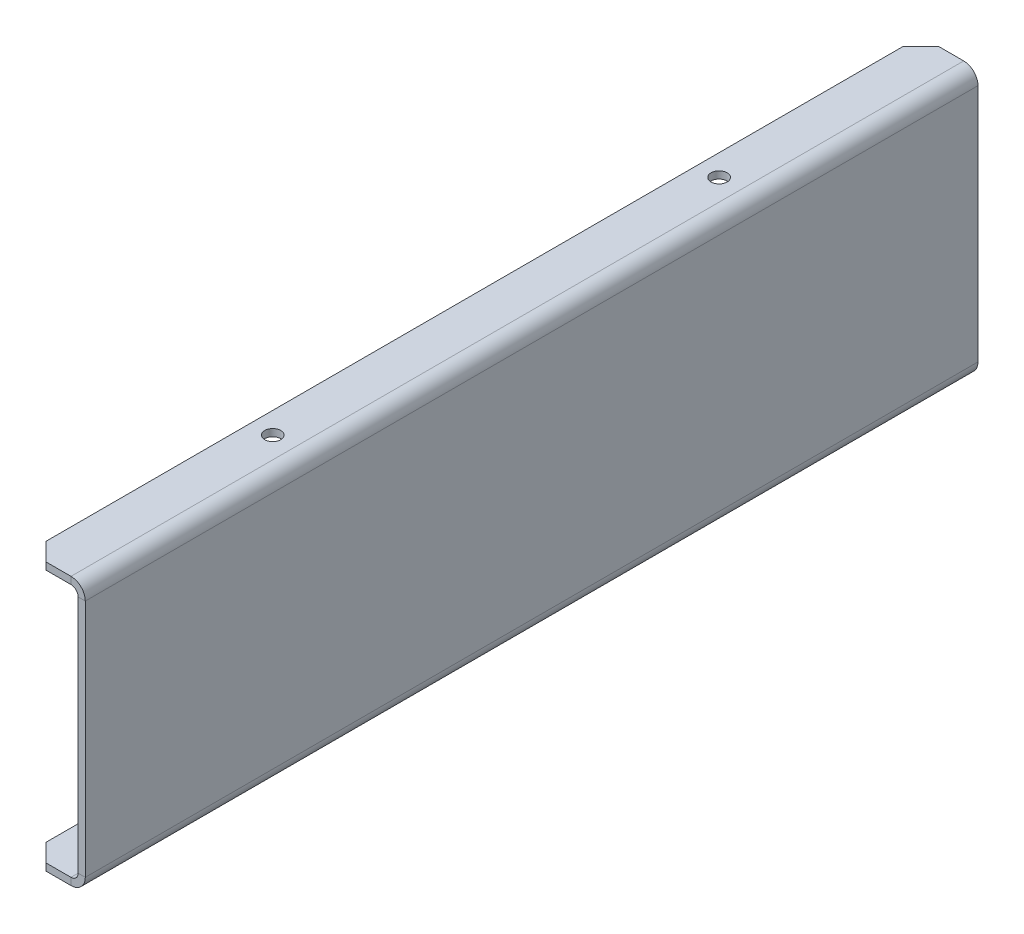
from build123d import *

# Parameters (mm, degrees)
BASE_FLANGE1_DEPTH = 250
CHAMFER1_SIZE      = 5
CUT_EXTRUDE1_REACH = 263.498
SKETCH3_R          = 2.25
CUT_EXTRUDE2_REACH = 263.498
SKETCH4_R          = 2.25


# Sheet-metal steps are written as plain solids
with BuildPart() as part:
    # Sketch1 → Base-Flange1 (new body)
    with BuildSketch(Plane.XY):
        with BuildLine():
            Line((-16, 37.5), (-4, 37.5))
            ThreePointArc((-4, 37.5), (-1.171572875, 36.328427125), (0, 33.5))
            Line((0, 33.5), (0, -33.5))
            ThreePointArc((0, -33.5), (-1.171572875, -36.328427125), (-4, -37.5))
            Line((-4, -37.5), (-16, -37.5))
            Line((-16, -37.5), (-16, -35.5))
            Line((-16, -35.5), (-4, -35.5))
            ThreePointArc((-4, -35.5), (-2.585786438, -34.914213562), (-2, -33.5))
            Line((-2, -33.5), (-2, 33.5))
            ThreePointArc((-2, 33.5), (-2.585786438, 34.914213562), (-4, 35.5))
            Line((-4, 35.5), (-16, 35.5))
            Line((-16, 35.5), (-16, 37.5))
        make_face()
    extrude(amount=BASE_FLANGE1_DEPTH)

    # Chamfer1
    chamfer1_edges = [part.edges().sort_by_distance(p)[0] for p in [
        (-16, 36.5, 0),
        (-16, -36.5, 0),
        (-16, 36.5, 250),
        (-16, -36.5, 250),
    ]]
    chamfer(chamfer1_edges, length=CHAMFER1_SIZE)

    # Sketch3 → Cut-Extrude1 (cut, up to next)
    with BuildSketch(Plane(origin=(0, 37.5, 0), x_dir=(1, 0, 0), z_dir=(0, 1, 0)), mode=Mode.PRIVATE) as cut_extrude1_sk1:
        with Locations(Location((-10, -62.5, 0), (0, 0, 270))):
            Circle(SKETCH3_R)
    cut_extrude1_tool1 = extrude(cut_extrude1_sk1.sketch, amount=-CUT_EXTRUDE1_REACH, mode=Mode.PRIVATE) & part.part
    # Sketch3 → Cut-Extrude1 (cut, up to next)
    with BuildSketch(Plane(origin=(0, 37.5, 0), x_dir=(1, 0, 0), z_dir=(0, 1, 0)), mode=Mode.PRIVATE) as cut_extrude1_sk2:
        with Locations(Location((-10, -187.5, 0), (0, 0, 180))):
            Circle(SKETCH3_R)
    cut_extrude1_tool2 = extrude(cut_extrude1_sk2.sketch, amount=-CUT_EXTRUDE1_REACH, mode=Mode.PRIVATE) & part.part
    add(cut_extrude1_tool1.solids().sort_by_distance((-10, 37.5, 62.5))[0], mode=Mode.SUBTRACT)
    add(cut_extrude1_tool2.solids().sort_by_distance((-10, 37.5, 187.5))[0], mode=Mode.SUBTRACT)

    # Sketch4 → Cut-Extrude2 (cut, up to next)
    with BuildSketch(Plane.XZ.offset(37.5), mode=Mode.PRIVATE) as cut_extrude2_sk1:
        with Locations(Location((-10, 31.25, 0), (0, 0, 270))):
            Circle(SKETCH4_R)
    cut_extrude2_tool1 = extrude(cut_extrude2_sk1.sketch, amount=-CUT_EXTRUDE2_REACH, mode=Mode.PRIVATE) & part.part
    # Sketch4 → Cut-Extrude2 (cut, up to next)
    with BuildSketch(Plane.XZ.offset(37.5), mode=Mode.PRIVATE) as cut_extrude2_sk2:
        with Locations(Location((-10, 93.75, 0), (0, 0, 270))):
            Circle(SKETCH4_R)
    cut_extrude2_tool2 = extrude(cut_extrude2_sk2.sketch, amount=-CUT_EXTRUDE2_REACH, mode=Mode.PRIVATE) & part.part
    # Sketch4 → Cut-Extrude2 (cut, up to next)
    with BuildSketch(Plane.XZ.offset(37.5), mode=Mode.PRIVATE) as cut_extrude2_sk3:
        with Locations(Location((-10, 156.25, 0), (0, 0, 270))):
            Circle(SKETCH4_R)
    cut_extrude2_tool3 = extrude(cut_extrude2_sk3.sketch, amount=-CUT_EXTRUDE2_REACH, mode=Mode.PRIVATE) & part.part
    # Sketch4 → Cut-Extrude2 (cut, up to next)
    with BuildSketch(Plane.XZ.offset(37.5), mode=Mode.PRIVATE) as cut_extrude2_sk4:
        with Locations(Location((-10, 218.75, 0), (0, 0, 270))):
            Circle(SKETCH4_R)
    cut_extrude2_tool4 = extrude(cut_extrude2_sk4.sketch, amount=-CUT_EXTRUDE2_REACH, mode=Mode.PRIVATE) & part.part
    add(cut_extrude2_tool1.solids().sort_by_distance((-10, -37.5, 31.25))[0], mode=Mode.SUBTRACT)
    add(cut_extrude2_tool2.solids().sort_by_distance((-10, -37.5, 93.75))[0], mode=Mode.SUBTRACT)
    add(cut_extrude2_tool3.solids().sort_by_distance((-10, -37.5, 156.25))[0], mode=Mode.SUBTRACT)
    add(cut_extrude2_tool4.solids().sort_by_distance((-10, -37.5, 218.75))[0], mode=Mode.SUBTRACT)


solid = part.part
